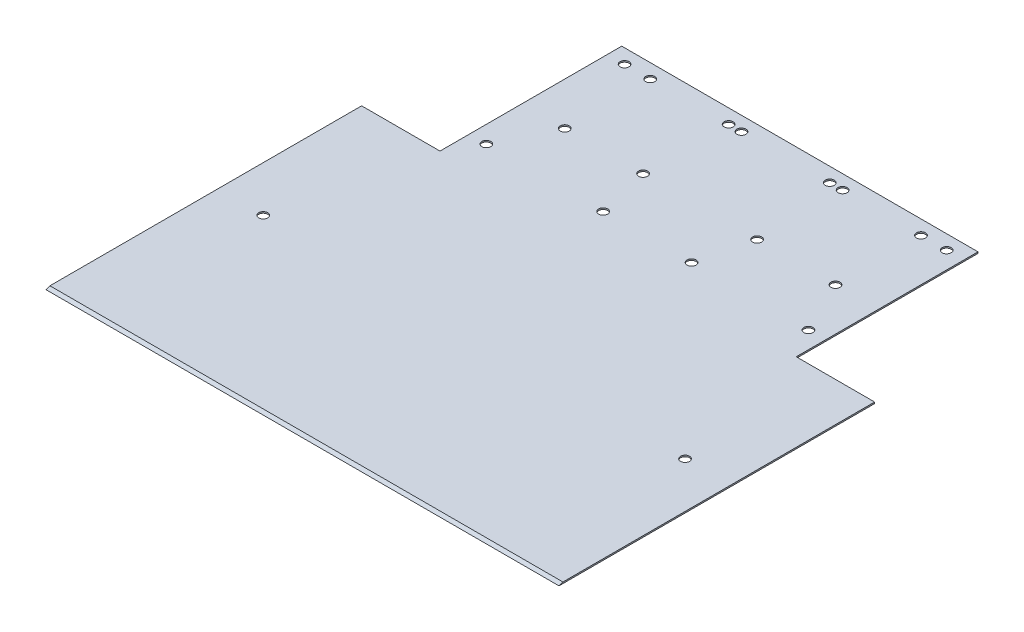
from build123d import *

# Parameters (mm, degrees)
SALIENTE_EXTRUIR1_DEPTH = 0.5
CORTAR_EXTRUIR4_REACH   = 128.793
CROQUIS6_R              = 1.585
CORTAR_EXTRUIR5_REACH   = 128.793
CROQUIS7_R              = 1.585
CORTAR_EXTRUIR6_REACH   = 128.793
CROQUIS8_R              = 1.585
CORTAR_EXTRUIR7_REACH   = 128.793
CROQUIS9_R              = 1.585
CORTAR_EXTRUIR8_REACH   = 128.793
CROQUIS5_R              = 1.585
CORTAR_EXTRUIR9_REACH   = 202.939


with BuildPart() as part:
    # Croquis2 → Saliente-Extruir1 (new body)
    with BuildSketch(Plane(origin=(0, 0, 0), x_dir=(1, 0, 0), z_dir=(0, 1, 0))):
        Polygon((-90, 25.54), (-62.5, 25.54), (-62.5, 89.31), (62.5, 89.31), (62.5, 25.54), (90, 25.54), (90, -85.2), (-90, -85.2), align=None)
    saliente_extruir1 = extrude(amount=SALIENTE_EXTRUIR1_DEPTH)

    # Croquis6 → Cortar-Extruir4 (cut, up to next)
    with BuildSketch(Plane(origin=(0, 0.5, 0), x_dir=(1, 0, 0), z_dir=(0, 1, 0)), mode=Mode.PRIVATE) as cortar_extruir4_sk1:
        with Locations((-56.5, 35.81)):
            Circle(CROQUIS6_R)
    cortar_extruir4_tool1 = extrude(cortar_extruir4_sk1.sketch, amount=-CORTAR_EXTRUIR4_REACH, mode=Mode.PRIVATE) & part.part
    # Croquis6 → Cortar-Extruir4 (cut, up to next)
    with BuildSketch(Plane(origin=(0, 0.5, 0), x_dir=(1, 0, 0), z_dir=(0, 1, 0)), mode=Mode.PRIVATE) as cortar_extruir4_sk2:
        with Locations((-15.5, 35.81)):
            Circle(CROQUIS6_R)
    cortar_extruir4_tool2 = extrude(cortar_extruir4_sk2.sketch, amount=-CORTAR_EXTRUIR4_REACH, mode=Mode.PRIVATE) & part.part
    # Croquis6 → Cortar-Extruir4 (cut, up to next)
    with BuildSketch(Plane(origin=(0, 0.5, 0), x_dir=(1, 0, 0), z_dir=(0, 1, 0)), mode=Mode.PRIVATE) as cortar_extruir4_sk3:
        with Locations((-15.5, 84.31)):
            Circle(CROQUIS6_R)
    cortar_extruir4_tool3 = extrude(cortar_extruir4_sk3.sketch, amount=-CORTAR_EXTRUIR4_REACH, mode=Mode.PRIVATE) & part.part
    # Croquis6 → Cortar-Extruir4 (cut, up to next)
    with BuildSketch(Plane(origin=(0, 0.5, 0), x_dir=(1, 0, 0), z_dir=(0, 1, 0)), mode=Mode.PRIVATE) as cortar_extruir4_sk4:
        with Locations((-56.5, 84.31)):
            Circle(CROQUIS6_R)
    cortar_extruir4_tool4 = extrude(cortar_extruir4_sk4.sketch, amount=-CORTAR_EXTRUIR4_REACH, mode=Mode.PRIVATE) & part.part
    add(cortar_extruir4_tool1.solids().sort_by_distance((-56.5, 0.5, -35.81))[0], mode=Mode.SUBTRACT)
    add(cortar_extruir4_tool2.solids().sort_by_distance((-15.5, 0.5, -35.81))[0], mode=Mode.SUBTRACT)
    add(cortar_extruir4_tool3.solids().sort_by_distance((-15.5, 0.5, -84.31))[0], mode=Mode.SUBTRACT)
    add(cortar_extruir4_tool4.solids().sort_by_distance((-56.5, 0.5, -84.31))[0], mode=Mode.SUBTRACT)

    # Croquis7 → Cortar-Extruir5 (cut, up to next)
    with BuildSketch(Plane(origin=(0, 0.5, 0), x_dir=(1, 0, 0), z_dir=(0, 1, 0)), mode=Mode.PRIVATE) as cortar_extruir5_sk1:
        with Locations((56.5, 35.81)):
            Circle(CROQUIS7_R)
    cortar_extruir5_tool1 = extrude(cortar_extruir5_sk1.sketch, amount=-CORTAR_EXTRUIR5_REACH, mode=Mode.PRIVATE) & part.part
    # Croquis7 → Cortar-Extruir5 (cut, up to next)
    with BuildSketch(Plane(origin=(0, 0.5, 0), x_dir=(1, 0, 0), z_dir=(0, 1, 0)), mode=Mode.PRIVATE) as cortar_extruir5_sk2:
        with Locations((15.5, 35.81)):
            Circle(CROQUIS7_R)
    cortar_extruir5_tool2 = extrude(cortar_extruir5_sk2.sketch, amount=-CORTAR_EXTRUIR5_REACH, mode=Mode.PRIVATE) & part.part
    # Croquis7 → Cortar-Extruir5 (cut, up to next)
    with BuildSketch(Plane(origin=(0, 0.5, 0), x_dir=(1, 0, 0), z_dir=(0, 1, 0)), mode=Mode.PRIVATE) as cortar_extruir5_sk3:
        with Locations((15.5, 84.31)):
            Circle(CROQUIS7_R)
    cortar_extruir5_tool3 = extrude(cortar_extruir5_sk3.sketch, amount=-CORTAR_EXTRUIR5_REACH, mode=Mode.PRIVATE) & part.part
    # Croquis7 → Cortar-Extruir5 (cut, up to next)
    with BuildSketch(Plane(origin=(0, 0.5, 0), x_dir=(1, 0, 0), z_dir=(0, 1, 0)), mode=Mode.PRIVATE) as cortar_extruir5_sk4:
        with Locations((56.5, 84.31)):
            Circle(CROQUIS7_R)
    cortar_extruir5_tool4 = extrude(cortar_extruir5_sk4.sketch, amount=-CORTAR_EXTRUIR5_REACH, mode=Mode.PRIVATE) & part.part
    add(cortar_extruir5_tool1.solids().sort_by_distance((56.5, 0.5, -35.81))[0], mode=Mode.SUBTRACT)
    add(cortar_extruir5_tool2.solids().sort_by_distance((15.5, 0.5, -35.81))[0], mode=Mode.SUBTRACT)
    add(cortar_extruir5_tool3.solids().sort_by_distance((15.5, 0.5, -84.31))[0], mode=Mode.SUBTRACT)
    add(cortar_extruir5_tool4.solids().sort_by_distance((56.5, 0.5, -84.31))[0], mode=Mode.SUBTRACT)

    # Simetría3: Saliente-Extruir1 across plane
    add(saliente_extruir1.mirror(Plane(origin=(0, 0, 0), x_dir=(0, 0, 1), z_dir=(1, 0, 0))))

    # Croquis8 → Cortar-Extruir6 (cut, up to next)
    with BuildSketch(Plane(origin=(0, 0.5, 0), x_dir=(1, 0, 0), z_dir=(0, 1, 0)), mode=Mode.PRIVATE) as cortar_extruir6_sk1:
        with Locations((-20, 54.31)):
            Circle(CROQUIS8_R)
    cortar_extruir6_tool1 = extrude(cortar_extruir6_sk1.sketch, amount=-CORTAR_EXTRUIR6_REACH, mode=Mode.PRIVATE) & part.part
    # Croquis8 → Cortar-Extruir6 (cut, up to next)
    with BuildSketch(Plane(origin=(0, 0.5, 0), x_dir=(1, 0, 0), z_dir=(0, 1, 0)), mode=Mode.PRIVATE) as cortar_extruir6_sk2:
        with Locations((-47.5, 54.31)):
            Circle(CROQUIS8_R)
    cortar_extruir6_tool2 = extrude(cortar_extruir6_sk2.sketch, amount=-CORTAR_EXTRUIR6_REACH, mode=Mode.PRIVATE) & part.part
    # Croquis8 → Cortar-Extruir6 (cut, up to next)
    with BuildSketch(Plane(origin=(0, 0.5, 0), x_dir=(1, 0, 0), z_dir=(0, 1, 0)), mode=Mode.PRIVATE) as cortar_extruir6_sk3:
        with Locations((-47.5, 84.31)):
            Circle(CROQUIS8_R)
    cortar_extruir6_tool3 = extrude(cortar_extruir6_sk3.sketch, amount=-CORTAR_EXTRUIR6_REACH, mode=Mode.PRIVATE) & part.part
    # Croquis8 → Cortar-Extruir6 (cut, up to next)
    with BuildSketch(Plane(origin=(0, 0.5, 0), x_dir=(1, 0, 0), z_dir=(0, 1, 0)), mode=Mode.PRIVATE) as cortar_extruir6_sk4:
        with Locations((-20, 84.31)):
            Circle(CROQUIS8_R)
    cortar_extruir6_tool4 = extrude(cortar_extruir6_sk4.sketch, amount=-CORTAR_EXTRUIR6_REACH, mode=Mode.PRIVATE) & part.part
    cortar_extruir6_1 = cortar_extruir6_tool1.solids().sort_by_distance((-20, 0.5, -54.31))[0]
    add(cortar_extruir6_1, mode=Mode.SUBTRACT)
    cortar_extruir6_2 = cortar_extruir6_tool2.solids().sort_by_distance((-47.5, 0.5, -54.31))[0]
    add(cortar_extruir6_2, mode=Mode.SUBTRACT)
    cortar_extruir6_3 = cortar_extruir6_tool3.solids().sort_by_distance((-47.5, 0.5, -84.31))[0]
    add(cortar_extruir6_3, mode=Mode.SUBTRACT)
    cortar_extruir6_4 = cortar_extruir6_tool4.solids().sort_by_distance((-20, 0.5, -84.31))[0]
    add(cortar_extruir6_4, mode=Mode.SUBTRACT)
    cortar_extruir6 = cortar_extruir6_1 + cortar_extruir6_2 + cortar_extruir6_3 + cortar_extruir6_4  # Cortar-Extruir6 as one shape, for the pattern or mirror that repeats it

    # Simetría4: Cortar-Extruir6 across plane
    add(cortar_extruir6.mirror(Plane(origin=(0, 0, 0), x_dir=(0, 0, 1), z_dir=(1, 0, 0))), mode=Mode.SUBTRACT)

    # Croquis9 → Cortar-Extruir7 (cut, up to next)
    with BuildSketch(Plane.XZ, mode=Mode.PRIVATE) as cortar_extruir7_sk1:
        with Locations((56.5, -35.81)):
            Circle(CROQUIS9_R)
    cortar_extruir7_tool1 = extrude(cortar_extruir7_sk1.sketch, amount=-CORTAR_EXTRUIR7_REACH, mode=Mode.PRIVATE) & part.part
    # Croquis9 → Cortar-Extruir7 (cut, up to next)
    with BuildSketch(Plane.XZ, mode=Mode.PRIVATE) as cortar_extruir7_sk2:
        with Locations((15.5, -35.81)):
            Circle(CROQUIS9_R)
    cortar_extruir7_tool2 = extrude(cortar_extruir7_sk2.sketch, amount=-CORTAR_EXTRUIR7_REACH, mode=Mode.PRIVATE) & part.part
    # Croquis9 → Cortar-Extruir7 (cut, up to next)
    with BuildSketch(Plane.XZ, mode=Mode.PRIVATE) as cortar_extruir7_sk3:
        with Locations((15.5, -84.31)):
            Circle(CROQUIS9_R)
    cortar_extruir7_tool3 = extrude(cortar_extruir7_sk3.sketch, amount=-CORTAR_EXTRUIR7_REACH, mode=Mode.PRIVATE) & part.part
    # Croquis9 → Cortar-Extruir7 (cut, up to next)
    with BuildSketch(Plane.XZ, mode=Mode.PRIVATE) as cortar_extruir7_sk4:
        with Locations((56.5, -84.31)):
            Circle(CROQUIS9_R)
    cortar_extruir7_tool4 = extrude(cortar_extruir7_sk4.sketch, amount=-CORTAR_EXTRUIR7_REACH, mode=Mode.PRIVATE) & part.part
    cortar_extruir7_1 = cortar_extruir7_tool1.solids().sort_by_distance((56.5, 0, -35.81))[0]
    add(cortar_extruir7_1, mode=Mode.SUBTRACT)
    cortar_extruir7_2 = cortar_extruir7_tool2.solids().sort_by_distance((15.5, 0, -35.81))[0]
    add(cortar_extruir7_2, mode=Mode.SUBTRACT)
    cortar_extruir7_3 = cortar_extruir7_tool3.solids().sort_by_distance((15.5, 0, -84.31))[0]
    add(cortar_extruir7_3, mode=Mode.SUBTRACT)
    cortar_extruir7_4 = cortar_extruir7_tool4.solids().sort_by_distance((56.5, 0, -84.31))[0]
    add(cortar_extruir7_4, mode=Mode.SUBTRACT)
    cortar_extruir7 = cortar_extruir7_1 + cortar_extruir7_2 + cortar_extruir7_3 + cortar_extruir7_4  # Cortar-Extruir7 as one shape, for the pattern or mirror that repeats it

    # Simetría5: Cortar-Extruir7 across plane
    add(cortar_extruir7.mirror(Plane(origin=(0, 0, 0), x_dir=(0, 0, 1), z_dir=(1, 0, 0))), mode=Mode.SUBTRACT)

    # Croquis5 → Cortar-Extruir8 (cut, up to next)
    with BuildSketch(Plane(origin=(0, 0.5, 0), x_dir=(1, 0, 0), z_dir=(0, 1, 0)), mode=Mode.PRIVATE) as cortar_extruir8_sk1:
        with Locations((74, -24.969940997)):
            Circle(CROQUIS5_R)
    cortar_extruir8_tool1 = extrude(cortar_extruir8_sk1.sketch, amount=-CORTAR_EXTRUIR8_REACH, mode=Mode.PRIVATE) & part.part
    cortar_extruir8 = cortar_extruir8_tool1.solids().sort_by_distance((74, 0.5, 24.969941))[0]
    add(cortar_extruir8, mode=Mode.SUBTRACT)

    # Simetría6: Cortar-Extruir8 across plane
    add(cortar_extruir8.mirror(Plane(origin=(0, 0, 0), x_dir=(0, 0, 1), z_dir=(1, 0, 0))), mode=Mode.SUBTRACT)

    # Croquis3 → Cortar-Extruir9 (cut, up to next)
    with BuildSketch(Plane(origin=(90, 0, 0), x_dir=(0, 0, -1), z_dir=(1, 0, 0)), mode=Mode.PRIVATE) as cortar_extruir9_sk1:
        Polygon((-85.2, 0), (-83.82626129, 0.5), (-85.2, 0.5), align=None)
    cortar_extruir9_tool1 = extrude(cortar_extruir9_sk1.sketch, amount=-CORTAR_EXTRUIR9_REACH, mode=Mode.PRIVATE) & part.part
    add(cortar_extruir9_tool1.solids().sort_by_distance((90, 0.333333, 84.742087))[0], mode=Mode.SUBTRACT)


solid = part.part
